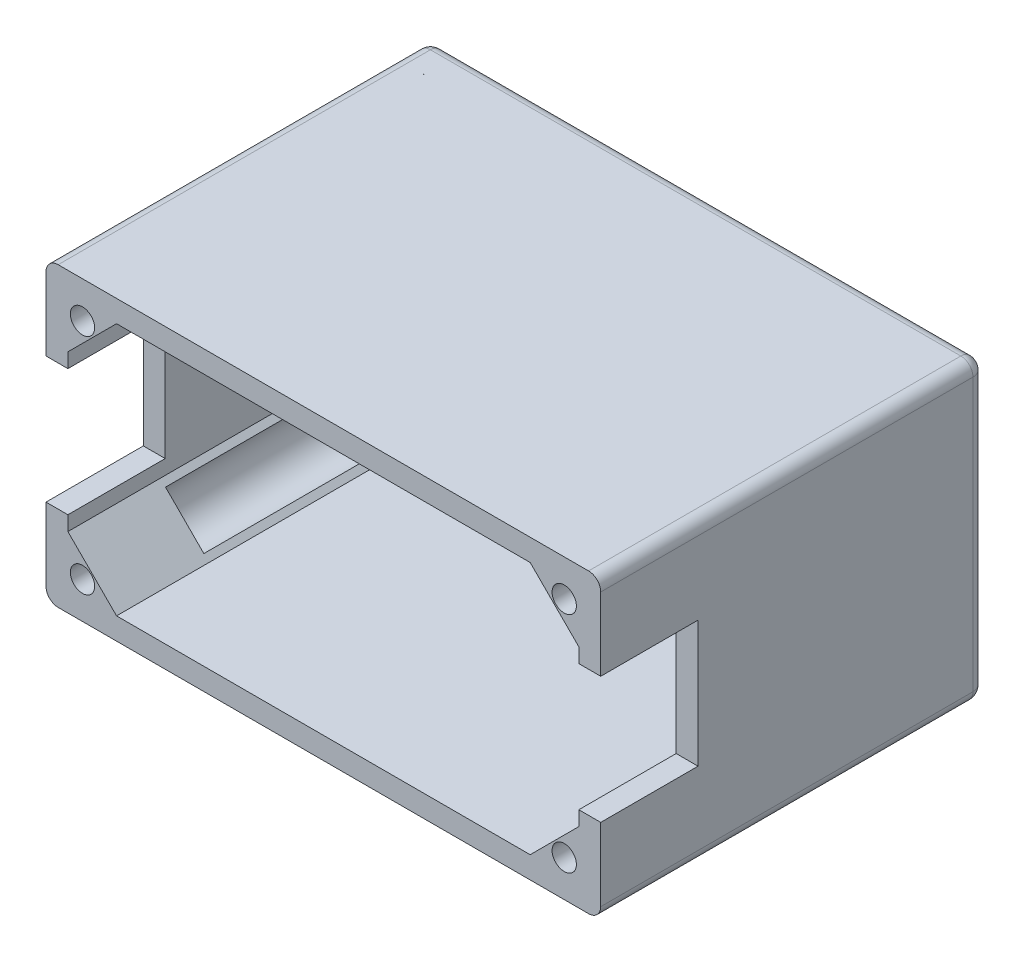
from build123d import *

# Parameters (mm, degrees)
SKETCH_1_W               = 22.8
SKETCH_1_H               = 12.2
EXTRUDE_1_DEPTH          = 15.8
SKETCH_2_W               = 21
SKETCH_2_H               = 10.4
CUT_EXTRUDE_1_DEPTH      = 13.8
SKETCH_4_W               = 0.9
SKETCH_4_H               = 5.2
CUT_EXTRUDE_2_DEPTH      = 4
CUT_EXTRUDE_5_DEPTH      = 2
FILLET_2_R               = 0.5
SKETCH_8_W               = 0.9
SKETCH_8_H               = 5.2
CUT_EXTRUDE_6_DEPTH      = 4
EXTRUDE_2_DEPTH          = 13.8
CUT_EXTRUDE_8_DEPTH      = 19.91057905
CUT_EXTRUDE_8_DEPTH_BACK = 19.91057905
SKETCH_3_R               = 0.5
SKETCH_9_R               = 1.25
CUT_EXTRUDE_9_DEPTH      = 12
FILLET_3_R               = 0.5


with BuildPart() as part:
    # 草图1 → 凸台-拉伸1 (new body)
    with BuildSketch(Plane.XY):
        Rectangle(SKETCH_1_W, SKETCH_1_H)
    extrude(amount=EXTRUDE_1_DEPTH)

    # 草图2 → 切除-拉伸1 (cut)
    with BuildSketch(Plane.XY.offset(15.8)):
        Rectangle(SKETCH_2_W, SKETCH_2_H)
    extrude(amount=-CUT_EXTRUDE_1_DEPTH, mode=Mode.SUBTRACT)

    # 草图4 → 切除-拉伸2 (cut)
    with BuildSketch(Plane.XY.offset(15.8)):
        with Locations((-10.95, 0)):
            Rectangle(SKETCH_4_W, SKETCH_4_H)
    extrude(amount=-CUT_EXTRUDE_2_DEPTH, mode=Mode.SUBTRACT)

    # 草图7 → 切除-拉伸5 (cut)
    with BuildSketch(Plane.XY.offset(2)):
        with BuildLine():
            Line((-5.85, -0.2), (5.15, -0.2))
            ThreePointArc((5.15, -0.2), (7.4, -2.45), (5.15, -4.7))
            Line((5.15, -4.7), (-5.85, -4.7))
            ThreePointArc((-5.85, -4.7), (-8.1, -2.45), (-5.85, -0.2))
        make_face()
    extrude(amount=-CUT_EXTRUDE_5_DEPTH, mode=Mode.SUBTRACT)

    # 圆角2
    fillet_2_edges = [part.edges().sort_by_distance(p)[0] for p in [
        (11.4, -6.1, 7.9),
        (-11.4, -6.1, 7.9),
        (-11.4, 6.1, 7.9),
        (11.4, 6.1, 7.9),
    ]]
    fillet(fillet_2_edges, radius=FILLET_2_R)

    # 草图8 → 切除-拉伸6 (cut)
    with BuildSketch(Plane.XY.offset(15.8)):
        with Locations((10.95, 0)):
            Rectangle(SKETCH_8_W, SKETCH_8_H)
    extrude(amount=-CUT_EXTRUDE_6_DEPTH, mode=Mode.SUBTRACT)

    # 草图10 → 凸台-拉伸2 (add)
    with BuildSketch(Plane.XY.offset(2)):
        Polygon((-10.5, 3.2), (-10.5, 5.2), (-8.5, 5.2), align=None)
        Polygon((8.5, 5.2), (10.5, 5.2), (10.5, 3.2), align=None)
        Polygon((10.5, -3.2), (10.5, -5.2), (8.5, -5.2), align=None)
        Polygon((-10.5, -3.2), (-10.5, -5.2), (-8.5, -5.2), align=None)
    extrude(amount=EXTRUDE_2_DEPTH)

    # 草图3 → 切除-拉伸8 (cut, two sides: drawn at the far end of the back side and taken through both)
    with BuildSketch(Plane.XY.offset(2).offset(-CUT_EXTRUDE_8_DEPTH_BACK)):
        with Locations((9.9, 4.6)):
            Circle(SKETCH_3_R)
        with Locations((-9.9, -4.6)):
            Circle(SKETCH_3_R)
        with Locations((9.9, -4.6)):
            Circle(SKETCH_3_R)
        with Locations((-9.9, 4.6)):
            Circle(SKETCH_3_R)
    extrude(amount=CUT_EXTRUDE_8_DEPTH + CUT_EXTRUDE_8_DEPTH_BACK, mode=Mode.SUBTRACT)

    # 草图9 → 切除-拉伸9 (cut)
    with BuildSketch(Plane(origin=(0, 0, 0), x_dir=(-1, 0, 0), z_dir=(0, 0, -1))):
        with Locations((-9.9, 4.6)):
            Circle(SKETCH_9_R)
        with Locations((9.9, 4.6)):
            Circle(SKETCH_9_R)
        with Locations((-9.9, -4.6)):
            Circle(SKETCH_9_R)
        with Locations((9.9, -4.6)):
            Circle(SKETCH_9_R)
    extrude(amount=-CUT_EXTRUDE_9_DEPTH, mode=Mode.SUBTRACT)

    # 圆角3
    # the kernel refuses this fillet: 0.5 mm, written as the material it takes off along each edge
    with BuildSketch(Plane(origin=(-10.9, 6.1, 0), x_dir=(0, 0, 1), z_dir=(1, 0, 0))) as fillet_3_piece_1:
        with BuildLine():
            CenterArc((FILLET_3_R, FILLET_3_R), FILLET_3_R, 180, 90)
            Line((0, FILLET_3_R), (0, 0))
            Line((0, 0), (FILLET_3_R, 0))
        make_face()
    extrude(amount=21.8, mode=Mode.SUBTRACT)
    with BuildSketch(Plane(origin=(11.4, 5.6, 0), x_dir=(-1, 0, 0), z_dir=(0, -1, 0)), Plane(origin=(-11.4, -5.6, 0), x_dir=(1, 0, 0), z_dir=(0, 1, 0))) as fillet_3_piece_2:
        with BuildLine():
            CenterArc((FILLET_3_R, -FILLET_3_R), FILLET_3_R, 90, 90)
            Line((0, -FILLET_3_R), (0, 0))
            Line((0, 0), (FILLET_3_R, 0))
        make_face()
    extrude(amount=11.2, mode=Mode.SUBTRACT)
    with BuildSketch(Plane(origin=(10.9, -6.1, 0), x_dir=(0, 1, 0), z_dir=(-1, 0, 0))) as fillet_3_piece_3:
        with BuildLine():
            CenterArc((FILLET_3_R, -FILLET_3_R), FILLET_3_R, 90, 90)
            Line((0, -FILLET_3_R), (0, 0))
            Line((0, 0), (FILLET_3_R, 0))
        make_face()
    extrude(amount=21.8, mode=Mode.SUBTRACT)
    with BuildSketch(Plane(origin=(-10.9, 5.6, 0), x_dir=(0, 1, 0), z_dir=(1, 0, 0))) as fillet_3_piece_4:
        with BuildLine():
            CenterArc((0.5 - FILLET_3_R, FILLET_3_R), FILLET_3_R, 270, 90)
            Line((0.5, FILLET_3_R), (0.5, 0))
            Line((0.5, 0), (0.5 - FILLET_3_R, 0))
        make_face()
    revolve(axis=Axis((-10.9, 5.6, 0), (0, 0, 1)), revolution_arc=90, mode=Mode.SUBTRACT)
    with BuildSketch(Plane(origin=(-10.9, -5.6, 0), x_dir=(-1, 0, 0), z_dir=(0, 1, 0))) as fillet_3_piece_5:
        with BuildLine():
            CenterArc((0.5 - FILLET_3_R, FILLET_3_R), FILLET_3_R, 270, 90)
            Line((0.5, FILLET_3_R), (0.5, 0))
            Line((0.5, 0), (0.5 - FILLET_3_R, 0))
        make_face()
    revolve(axis=Axis((-10.9, -5.6, 0), (0, 0, 1)), revolution_arc=90, mode=Mode.SUBTRACT)
    with BuildSketch(Plane(origin=(10.9, -5.6, 0), x_dir=(1, 0, 0), z_dir=(0, 1, 0))) as fillet_3_piece_6:
        with BuildLine():
            CenterArc((0.5 - FILLET_3_R, -FILLET_3_R), FILLET_3_R, 0, 90)
            Line((0.5, -FILLET_3_R), (0.5, 0))
            Line((0.5, 0), (0.5 - FILLET_3_R, 0))
        make_face()
    revolve(axis=Axis((10.9, -5.6, 0), (0, 0, -1)), revolution_arc=90, mode=Mode.SUBTRACT)
    with BuildSketch(Plane(origin=(10.9, 5.6, 0), x_dir=(0, 1, 0), z_dir=(-1, 0, 0))) as fillet_3_piece_7:
        with BuildLine():
            CenterArc((0.5 - FILLET_3_R, -FILLET_3_R), FILLET_3_R, 0, 90)
            Line((0.5, -FILLET_3_R), (0.5, 0))
            Line((0.5, 0), (0.5 - FILLET_3_R, 0))
        make_face()
    revolve(axis=Axis((10.9, 5.6, 0), (0, 0, -1)), revolution_arc=90, mode=Mode.SUBTRACT)


solid = part.part
